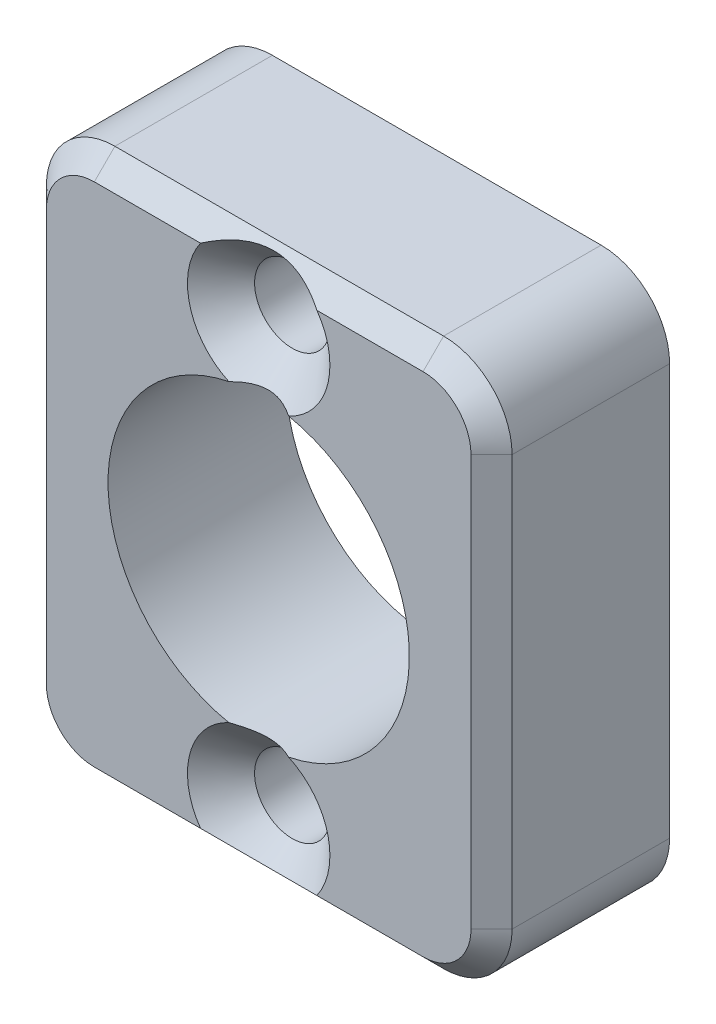
from build123d import *

# Parameters (mm, degrees)
SKETCH_1_W                 = 34
SKETCH_1_H                 = 40
EXTRUDE_273_DEPTH          = 13
SKETCH_2_R                 = 11
CUT_EXTRUDE_457_DEPTH      = 13
HOLE_WIZARD_M6_D           = 5.5
HOLE_WIZARD_M6_CSINK_D     = 10.4
HOLE_WIZARD_M6_CSINK_ANGLE = 90
FILLET_1404_R              = 5
CHAMFER_1_SIZE             = 1.5


with BuildPart() as part:
    # Эскиз1 → Extrude 273 (new body)
    with BuildSketch(Plane.XY):
        Rectangle(SKETCH_1_W, SKETCH_1_H)
    extrude(amount=-EXTRUDE_273_DEPTH)

    # Эскиз2 → Cut-Extrude 457 (cut)
    with BuildSketch(Plane.XY.offset(-13)):
        with Locations(Location((0, 0, 0), (0, 0, 180))):
            Circle(SKETCH_2_R)
    extrude(amount=CUT_EXTRUDE_457_DEPTH, mode=Mode.SUBTRACT)

    # КреплениеM6 (through all)
    with Locations(Plane.XY):
        with Locations((0, 15.5), (0, -15.5)):
            CounterSinkHole(HOLE_WIZARD_M6_D / 2, HOLE_WIZARD_M6_CSINK_D / 2, counter_sink_angle=HOLE_WIZARD_M6_CSINK_ANGLE)

    # Fillet 1404
    fillet_1404_edges = [part.edges().sort_by_distance(p)[0] for p in [
        (17, -20, -6.5),
        (-17, -20, -6.5),
        (-17, 20, -6.5),
        (17, 20, -6.5),
    ]]
    fillet(fillet_1404_edges, radius=FILLET_1404_R)

    # Фаска1
    # the kernel refuses this chamfer: 1.5 mm, written as the material it takes off along each edge
    with BuildSketch(Plane(origin=(-12, -15, 0), x_dir=(-1, 0, 0), z_dir=(0, 1, 0))) as chamfer_1_piece_1:
        Polygon((5 - CHAMFER_1_SIZE, 0), (5, -CHAMFER_1_SIZE), (5, 0), align=None)
    revolve(axis=Axis((-12, -15, 0), (0, 0, 1)), revolution_arc=90, mode=Mode.SUBTRACT)
    with BuildSketch(Plane(origin=(1.251761638, -20, 0), x_dir=(0, 0.9996219169112968, 0.02749587661058636), z_dir=(-1, 0, 0)), Plane(origin=(12, -20, 0), x_dir=(0, 0.9996219169112968, 0.02749587661058636), z_dir=(-1, 0, 0))) as chamfer_1_piece_2:
        Polygon((CHAMFER_1_SIZE * 0.999621916911, CHAMFER_1_SIZE * 0.0274958766106), (-CHAMFER_1_SIZE * 0.0274958766106, CHAMFER_1_SIZE * 0.999621916911), (0, 0), align=None)
    extrude(amount=13.251761638, mode=Mode.SUBTRACT)
    with BuildSketch(Plane(origin=(12, -15, 0), x_dir=(0, -1, 0), z_dir=(-1, 0, 0))) as chamfer_1_piece_3:
        Polygon((5 - CHAMFER_1_SIZE, 0), (5, -CHAMFER_1_SIZE), (5, 0), align=None)
    revolve(axis=Axis((12, -15, 0), (0, 0, 1)), revolution_arc=90, mode=Mode.SUBTRACT)
    with BuildSketch(Plane(origin=(17, 15, 0), x_dir=(-0.9996219169112968, 0, 0.02749587661058636), z_dir=(0, -1, 0)), Plane(origin=(-17, -15, 0), x_dir=(0.9996219169112968, 0, 0.02749587661058636), z_dir=(0, 1, 0))) as chamfer_1_piece_4:
        Polygon((CHAMFER_1_SIZE * 0.999621916911, CHAMFER_1_SIZE * 0.0274958766106), (-CHAMFER_1_SIZE * 0.0274958766106, CHAMFER_1_SIZE * 0.999621916911), (0, 0), align=None)
    extrude(amount=30, mode=Mode.SUBTRACT)
    with BuildSketch(Plane(origin=(12, 15, 0), x_dir=(0, 1, 0), z_dir=(-1, 0, 0))) as chamfer_1_piece_5:
        Polygon((5 - CHAMFER_1_SIZE, 0), (5, CHAMFER_1_SIZE), (5, 0), align=None)
    revolve(axis=Axis((12, 15, 0), (0, 0, -1)), revolution_arc=90, mode=Mode.SUBTRACT)
    with BuildSketch(Plane(origin=(-12, 20, 0), x_dir=(0, 0.027495876610586778, -0.9996219169112968), z_dir=(1, 0, 0)), Plane(origin=(-1.251761638, 20, 0), x_dir=(0, 0.027495876610586778, -0.9996219169112968), z_dir=(1, 0, 0))) as chamfer_1_piece_6:
        Polygon((CHAMFER_1_SIZE * 0.999621916911, -CHAMFER_1_SIZE * 0.0274958766106), (-CHAMFER_1_SIZE * 0.0274958766106, -CHAMFER_1_SIZE * 0.999621916911), (0, 0), align=None)
    extrude(amount=13.251761638, mode=Mode.SUBTRACT)
    with BuildSketch(Plane(origin=(-12, 15, 0), x_dir=(0, 1, 0), z_dir=(1, 0, 0))) as chamfer_1_piece_7:
        Polygon((5 - CHAMFER_1_SIZE, 0), (5, -CHAMFER_1_SIZE), (5, 0), align=None)
    revolve(axis=Axis((-12, 15, 0), (0, 0, 1)), revolution_arc=90, mode=Mode.SUBTRACT)


solid = part.part
